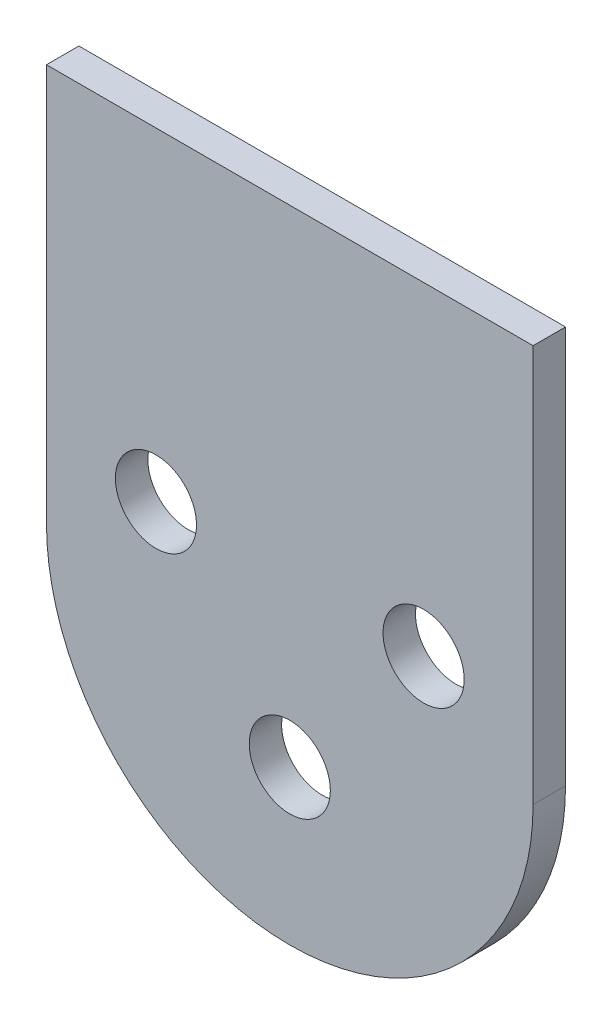
from build123d import *

# Parameters (mm, degrees)
SKETCH_1_R      = 2.5
EXTRUDE_1_DEPTH = 2


with BuildPart() as part:
    # 草图1 → 凸台-拉伸1 (new body)
    with BuildSketch(Plane.XY):
        with BuildLine():
            Line((15, 0), (-15, 0))
            Line((-15, 0), (-15, -24.5))
            ThreePointArc((-15, -24.5), (0, -39.5), (15, -24.5))
            Line((15, -24.5), (15, 0))
        make_face()
        with Locations((8.25, -19.953234351)):
            Circle(SKETCH_1_R, mode=Mode.SUBTRACT)
        with Locations((0, -30)):
            Circle(SKETCH_1_R, mode=Mode.SUBTRACT)
        with Locations((-8.25, -19.953234351)):
            Circle(SKETCH_1_R, mode=Mode.SUBTRACT)
    extrude(amount=EXTRUDE_1_DEPTH)


solid = part.part
